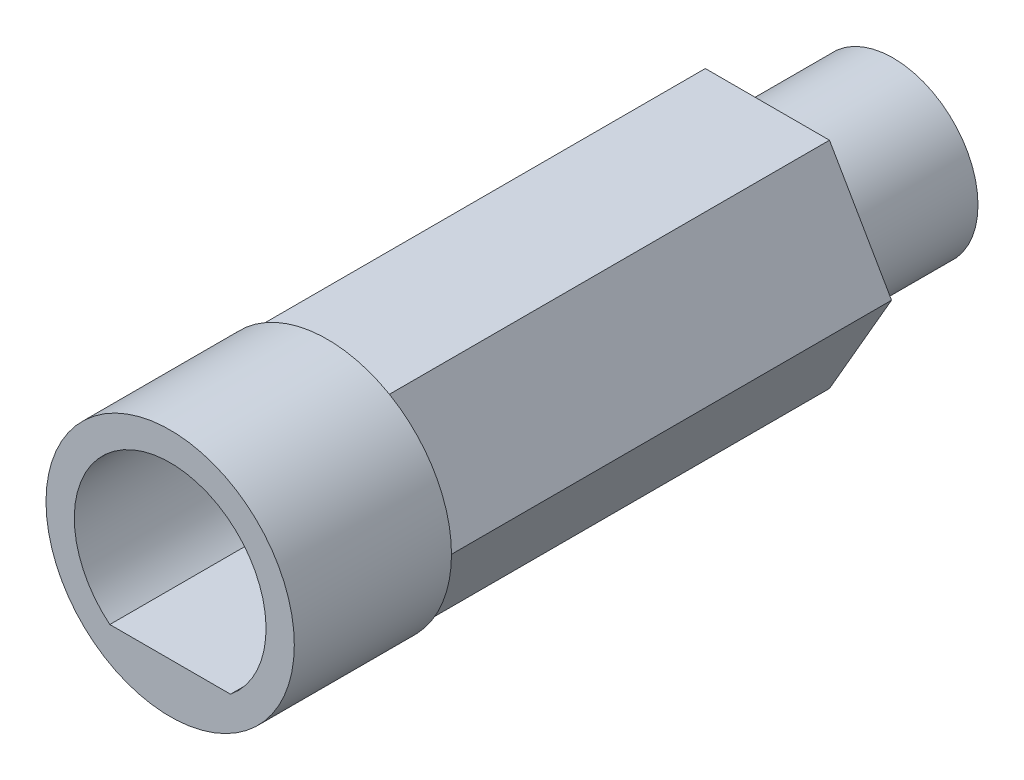
from build123d import *

# Parameters (mm, degrees)
BOSS_EXTRUDE1_DEPTH = 14
SKETCH2_R           = 3.95
BOSS_EXTRUDE2_DEPTH = 5
SKETCH3_R           = 2.7
BOSS_EXTRUDE3_DEPTH = 4
CUT_EXTRUDE1_DEPTH  = 16


with BuildPart() as part:
    # Sketch1 → Boss-Extrude1 (new body)
    with BuildSketch(Plane.XY):
        Polygon((3.95, 0), (1.975, 3.420800345), (-1.975, 3.420800345), (-3.95, 0), (-1.975, -3.420800345), (1.975, -3.420800345), align=None)
    extrude(amount=BOSS_EXTRUDE1_DEPTH)

    # Sketch2 → Boss-Extrude2 (add)
    with BuildSketch(Plane.XY.offset(14)):
        Circle(SKETCH2_R)
    extrude(amount=BOSS_EXTRUDE2_DEPTH)

    # Sketch3 → Boss-Extrude3 (add)
    with BuildSketch(Plane(origin=(0, 0, 0), x_dir=(-1, 0, 0), z_dir=(0, 0, -1))):
        Circle(SKETCH3_R)
    extrude(amount=BOSS_EXTRUDE3_DEPTH)

    # Sketch4 → Cut-Extrude1 (cut)
    with BuildSketch(Plane.XY.offset(19)):
        with BuildLine():
            ThreePointArc((3.05, 0), (-1.312847183, 2.752986065), (-1.919791655, -2.37))
            Line((-1.919791655, -2.37), (1.919791655, -2.37))
            ThreePointArc((1.919791655, -2.37), (2.752986065, -1.312847183), (3.05, 0))
        make_face()
    extrude(amount=-CUT_EXTRUDE1_DEPTH, mode=Mode.SUBTRACT)


solid = part.part
